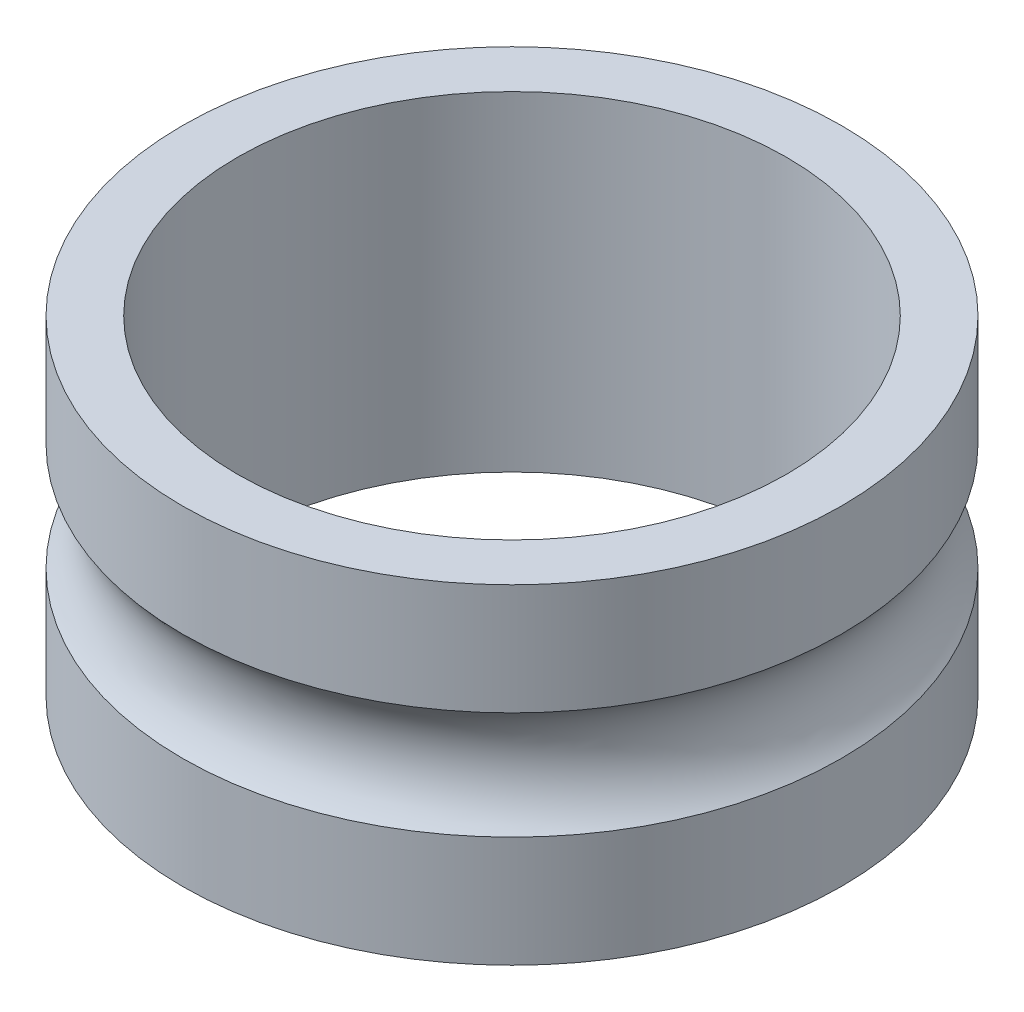
from build123d import *

# Parameters (mm, degrees)
DIAPROFILES_R         = 3
DIAPROFILES_R_2       = 2.5
DIAPROFILE_DEPTH      = 1.5
BEARINGPATHPROFILES_R = 0.7


with BuildPart() as part:
    # DiaProfileS → DiaProfile (new, symmetric)
    with BuildSketch(Plane(origin=(0, 0, 0), x_dir=(1, 0, 0), z_dir=(0, 1, 0))):
        Circle(DIAPROFILES_R)
        Circle(DIAPROFILES_R_2, mode=Mode.SUBTRACT)
    extrude(amount=DIAPROFILE_DEPTH, both=True)

    # BearingPathProfileS → BearingPathProfile (revolve, cut)
    with BuildSketch(Plane.XY):
        with Locations((3.5, 0)):
            Circle(BEARINGPATHPROFILES_R)
    revolve(axis=Axis((0, 1.5, 0), (0, -1, 0)), mode=Mode.SUBTRACT)


solid = part.part
